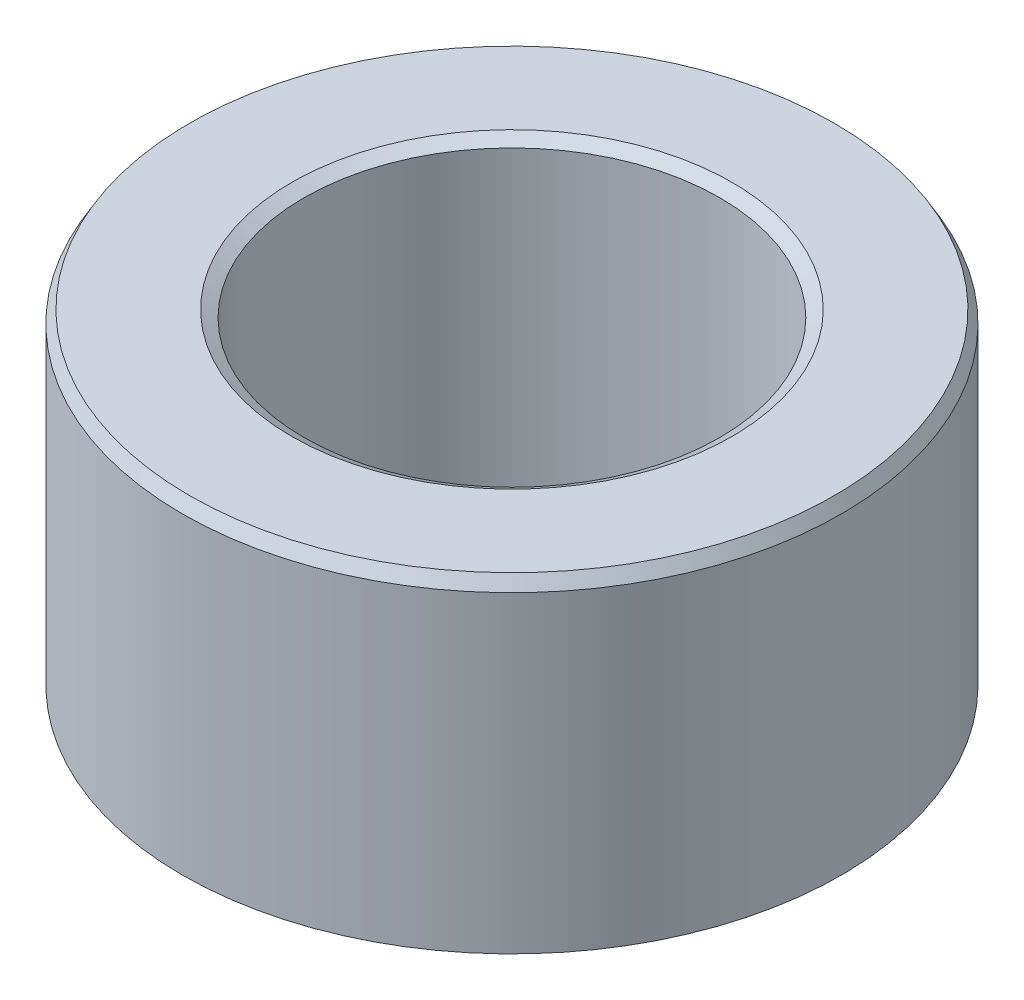
from build123d import *
from OCP.BRepFilletAPI import BRepFilletAPI_MakeChamfer

# Parameters (mm, degrees)
SKETCH1_R           = 45
BOSS_EXTRUDE1_DEPTH = 45.363633023
SKETCH2_R           = 28.377321027
CUT_EXTRUDE1_DEPTH  = 79.152793943
CHAMFER1_SIZE       = 1.68142072
CHAMFER1_SIZE2      = 0.970768705


with BuildPart() as part:
    # Sketch1 → Boss-Extrude1 (new body)
    with BuildSketch(Plane(origin=(0, 0, 0), x_dir=(1, 0, 0), z_dir=(0, 1, 0))):
        Circle(SKETCH1_R)
    extrude(amount=BOSS_EXTRUDE1_DEPTH)

    # Sketch2 → Cut-Extrude1 (cut, through all)
    with BuildSketch(Plane(origin=(0, 0, 0), x_dir=(1, 0, 0), z_dir=(0, 1, 0))):
        Circle(SKETCH2_R)
    extrude(amount=CUT_EXTRUDE1_DEPTH, mode=Mode.SUBTRACT)

    # Chamfer1: one chamfer whose edges measure the first distance from different faces: ONE call of the kernel's chamfer builder (chamfer() names one face for all edges)
    chamfer1_edges_1 = [part.edges().sort_by_distance(p)[0] for p in [
        (-28.377321027, 45.363633023, 0),
    ]]
    chamfer1_side_1 = [part.faces().sort_by_distance(p)[0] for p in [
        (-43.727207794, 45.363633023, 0),
    ]]
    chamfer1_edges_2 = [part.edges().sort_by_distance(p)[0] for p in [
        (-28.377321027, 0, 0),
    ]]
    chamfer1_side_2 = [part.faces().sort_by_distance(p)[0] for p in [
        (-28.377321027, 22.681816512, 0),
    ]]
    chamfer1_edges_3 = [part.edges().sort_by_distance(p)[0] for p in [
        (-45, 0, 0),
    ]]
    chamfer1_side_3 = [part.faces().sort_by_distance(p)[0] for p in [
        (-43.727207794, 0, 0),
    ]]
    chamfer1_edges_4 = [part.edges().sort_by_distance(p)[0] for p in [
        (-45, 45.363633023, 0),
    ]]
    chamfer1_side_4 = [part.faces().sort_by_distance(p)[0] for p in [
        (-45, 22.681816512, 0),
    ]]
    chamfer1 = BRepFilletAPI_MakeChamfer(part.part.solid().wrapped)
    for e in chamfer1_edges_1:
        chamfer1.Add(CHAMFER1_SIZE, CHAMFER1_SIZE2, e.wrapped, chamfer1_side_1[0].wrapped)  # the first distance lies on this face
    for e in chamfer1_edges_2:
        chamfer1.Add(CHAMFER1_SIZE, CHAMFER1_SIZE2, e.wrapped, chamfer1_side_2[0].wrapped)  # the first distance lies on this face
    for e in chamfer1_edges_3:
        chamfer1.Add(CHAMFER1_SIZE, CHAMFER1_SIZE2, e.wrapped, chamfer1_side_3[0].wrapped)  # the first distance lies on this face
    for e in chamfer1_edges_4:
        chamfer1.Add(CHAMFER1_SIZE, CHAMFER1_SIZE2, e.wrapped, chamfer1_side_4[0].wrapped)  # the first distance lies on this face
    add(Compound.cast(chamfer1.Shape()), mode=Mode.REPLACE)


solid = part.part
